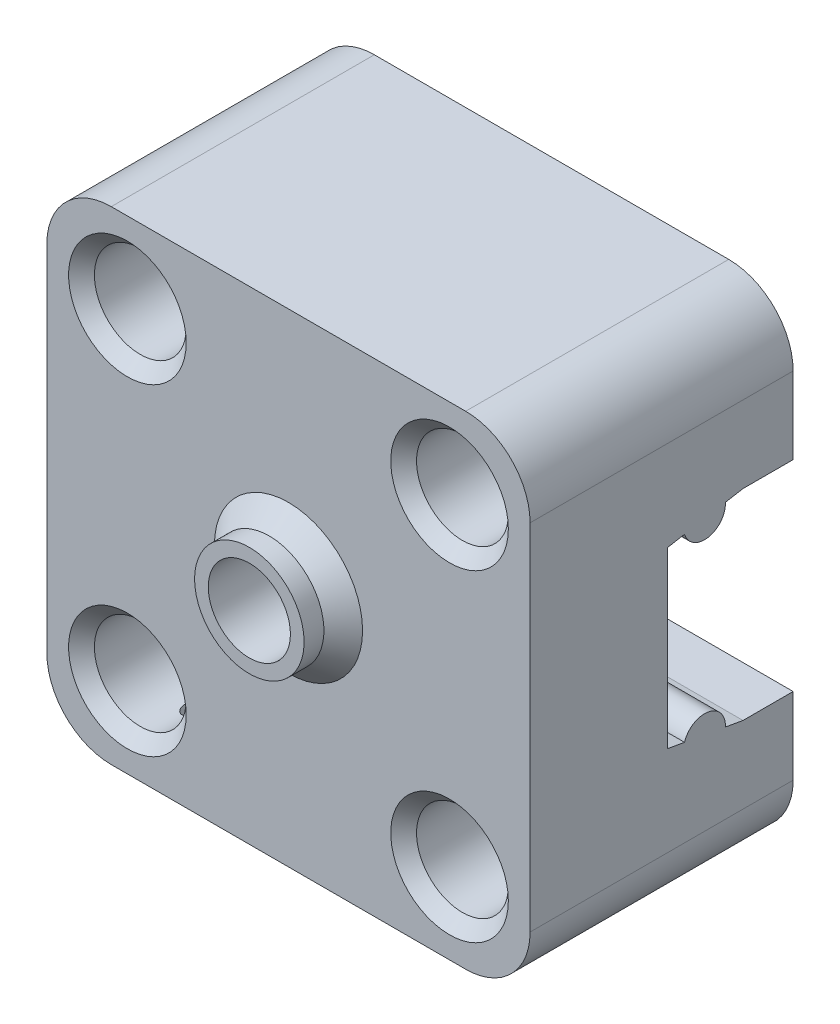
from build123d import *

# Parameters (mm, degrees)
SKETCH1_W                  = 30
SKETCH1_H                  = 30
SKETCH1_R                  = 1.6
SKETCH1_W_2                = 70
SKETCH1_H_2                = 12
BOSS_EXTRUDE1_DEPTH        = 6
SKETCH1_3_W                = 30
SKETCH1_3_H                = 30
SKETCH1_3_R                = 1.6
BOSS_EXTRUDE2_DEPTH        = 22.33
CUT_EXTRUDE1_DEPTH         = 78.612040947
SKETCH3_R                  = 2.55
CUT_EXTRUDE2_DEPTH         = 8
CUT_EXTRUDE3_DEPTH         = 4.5
SKETCH6_R                  = 5
CUT_EXTRUDE5_DEPTH         = 8.6
SKETCH7_R                  = 1.6
CUT_EXTRUDE6_DEPTH         = 101.740403513
SKETCH8_R                  = 2.85
CUT_EXTRUDE7_DEPTH         = 11
BOSS_EXTRUDE3_START        = 2.43
SKETCH9_R                  = 3.4
SKETCH9_R_2                = 2.55
BOSS_EXTRUDE3_DEPTH        = 2.43
CHAMFER1_SIZE              = 1.2
FILLET3_R                  = 4
CHAMFER2_SIZE              = 0.8
CUT_EXTRUDE8_DEPTH         = 3
CHAMFER3_SIZE              = 0.8
LPATTERN1_COUNT            = 3
LPATTERN1_PITCH            = 25
CHAMFER3_OF_LPATTERN1_SIZE = 0.8
SKETCH12_W                 = 103.210606925
SKETCH12_H                 = 33.832940417
CUT_EXTRUDE9_DEPTH         = 6
SKETCH13_R                 = 0.8
CUT_EXTRUDE10_DEPTH        = 5


with BuildPart() as part:
    # Sketch1 → Boss-Extrude1 (new body)
    # profile 1 of 2: a face of its own
    with BuildSketch(Plane.XY):
        with Locations((10, 10)):
            Rectangle(SKETCH1_W, SKETCH1_H)
        with Locations((20, 0)):
            Circle(SKETCH1_R, mode=Mode.SUBTRACT)
        with Locations((20, 20)):
            Circle(SKETCH1_R, mode=Mode.SUBTRACT)
        with Locations((0, 20)):
            Circle(SKETCH1_R, mode=Mode.SUBTRACT)
        Circle(SKETCH1_R, mode=Mode.SUBTRACT)
    # profile 2 of 2: a face of its own
    with BuildSketch(Plane.XY):
        with Locations((60, 10)):
            Rectangle(SKETCH1_W_2, SKETCH1_H_2)
    extrude(amount=BOSS_EXTRUDE1_DEPTH)

    # Sketch1<3> → Boss-Extrude2 (add)
    with BuildSketch(Plane.XY):
        with Locations((10, 10)):
            Rectangle(SKETCH1_3_W, SKETCH1_3_H)
        with Locations((20, 0)):
            Circle(SKETCH1_3_R, mode=Mode.SUBTRACT)
        with Locations((20, 20)):
            Circle(SKETCH1_3_R, mode=Mode.SUBTRACT)
        with Locations((0, 20)):
            Circle(SKETCH1_3_R, mode=Mode.SUBTRACT)
        Circle(SKETCH1_3_R, mode=Mode.SUBTRACT)
    extrude(amount=BOSS_EXTRUDE2_DEPTH)

    # Sketch2 → Cut-Extrude1 (cut, through all)
    with BuildSketch(Plane(origin=(25, 0, 0), x_dir=(0, 0, -1), z_dir=(1, 0, 0))):
        with BuildLine():
            Line((-6.515476918, 16.231667643), (-9.112158418, 16.231667643))
            Line((-9.112158418, 16.231667643), (-10.20449761, 16.039058771))
            ThreePointArc((-10.20449761, 16.039058771), (-11.275650893, 14.693383456), (-12.742453793, 15.59154862))
            Line((-12.742453793, 15.59154862), (-13.786185118, 15.407510627))
            Line((-13.786185118, 15.407510627), (-13.786185118, 4.591753459))
            Line((-13.786185118, 4.591753459), (-12.742453793, 4.407715465))
            ThreePointArc((-12.742453793, 4.407715465), (-11.275650893, 5.305880629), (-10.20449761, 3.960205314))
            Line((-10.20449761, 3.960205314), (-9.112158418, 3.767596443))
            Line((-9.112158418, 3.767596443), (-6.515476918, 3.767596443))
            Line((-6.515476918, 3.767596443), (-5.902540869, 3.767596443))
            Line((-5.902540869, 3.767596443), (-5.902540869, 16.231667643))
            Line((-5.902540869, 16.231667643), (-6.515476918, 16.231667643))
        make_face()
    extrude(amount=-CUT_EXTRUDE1_DEPTH, mode=Mode.SUBTRACT)

    # Sketch3 → Cut-Extrude2 (cut)
    with BuildSketch(Plane.XY.offset(22.33)):
        with Locations((10, 10)):
            Circle(SKETCH3_R)
    extrude(amount=-CUT_EXTRUDE2_DEPTH, mode=Mode.SUBTRACT)

    # Sketch5 → Cut-Extrude3 (cut)
    with BuildSketch(Plane(origin=(0, 0, 13.786185118), x_dir=(-1, 0, 0), z_dir=(0, 0, -1))):
        Polygon((-5.32346282, 10), (-7.66173141, 14.05), (-12.33826859, 14.05), (-14.67653718, 10), (-12.33826859, 5.95), (-7.66173141, 5.95), align=None)
    extrude(amount=-CUT_EXTRUDE3_DEPTH, mode=Mode.SUBTRACT)

    # Sketch6 → Cut-Extrude5 (cut)
    with BuildSketch(Plane(origin=(0, 0, 0), x_dir=(-1, 0, 0), z_dir=(0, 0, -1))):
        with Locations((-10, 10)):
            Circle(SKETCH6_R)
    extrude(amount=-CUT_EXTRUDE5_DEPTH, mode=Mode.SUBTRACT)

    # Sketch7 → Cut-Extrude6 (cut, through all)
    with BuildSketch(Plane(origin=(0, 0, 0), x_dir=(-1, 0, 0), z_dir=(0, 0, -1))):
        with BuildLine():
            ThreePointArc((-90.1, 10), (-88.5, 8.4), (-86.9, 10))
            Line((-86.9, 10), (-90.1, 10))
        make_face()
        with BuildLine():
            Line((-90.1, 10), (-86.9, 10))
            ThreePointArc((-86.9, 10), (-88.5, 11.6), (-90.1, 10))
        make_face()
        with Locations((-63.5, 10)):
            Circle(SKETCH7_R)
        with Locations((-38.5, 10)):
            Circle(SKETCH7_R)
    extrude(amount=-CUT_EXTRUDE6_DEPTH, mode=Mode.SUBTRACT)

    # Sketch8 → Cut-Extrude7 (cut)
    with BuildSketch(Plane.XY.offset(22.33)):
        with Locations((20, 20)):
            Circle(SKETCH8_R)
        with Locations((20, 0)):
            Circle(SKETCH8_R)
        Circle(SKETCH8_R)
        with Locations((0, 20)):
            Circle(SKETCH8_R)
    extrude(amount=-CUT_EXTRUDE7_DEPTH, mode=Mode.SUBTRACT)

    # Sketch9 → Boss-Extrude3 (add)
    with BuildSketch(Plane.XY.offset(22.33).offset(BOSS_EXTRUDE3_START)):
        with Locations(Location((10, 10, 0), (0, 0, 180))):
            Circle(SKETCH9_R)
        with Locations((10, 10)):
            Circle(SKETCH9_R_2, mode=Mode.SUBTRACT)
    extrude(amount=-BOSS_EXTRUDE3_DEPTH)

    # Chamfer1
    chamfer1_edges = [part.edges().sort_by_distance(p)[0] for p in [
        (13.4, 10, 22.33),
    ]]
    chamfer(chamfer1_edges, length=CHAMFER1_SIZE)

    # Fillet3
    # the kernel refuses this fillet: 4 mm, written as the material it adds along each edge
    with BuildSketch(Plane(origin=(25, 4, 0), x_dir=(0, -1, 0), z_dir=(0, 0, 1))) as fillet3_piece_1:
        with BuildLine():
            CenterArc((FILLET3_R, FILLET3_R), FILLET3_R, 180, 90)
            Line((0, FILLET3_R), (0, 0))
            Line((0, 0), (FILLET3_R, 0))
        make_face()
    extrude(amount=5.902540869)
    with BuildSketch(Plane(origin=(25, 16, 0), x_dir=(0, 1, 0), z_dir=(0, 0, 1))) as fillet3_piece_2:
        with BuildLine():
            CenterArc((FILLET3_R, -FILLET3_R), FILLET3_R, 90, 90)
            Line((0, -FILLET3_R), (0, 0))
            Line((0, 0), (FILLET3_R, 0))
        make_face()
    extrude(amount=5.902540869)
    # the kernel refuses this fillet: 4 mm, written as the material it takes off along each edge
    with BuildSketch(Plane(origin=(-5, -5, 32.33), x_dir=(1, 0, 0), z_dir=(0, 0, -1)), Plane(origin=(-5, 25, 32.33), x_dir=(0, -1, 0), z_dir=(0, 0, -1)), Plane(origin=(25, 25, -10), x_dir=(0, -1, 0), z_dir=(0, 0, 1)), Plane(origin=(25, -5, -10), x_dir=(-1, 0, 0), z_dir=(0, 0, 1))) as fillet3_2_piece_1:
        with BuildLine():
            CenterArc((FILLET3_R, -FILLET3_R), FILLET3_R, 90, 90)
            Line((0, -FILLET3_R), (0, 0))
            Line((0, 0), (FILLET3_R, 0))
        make_face()
    extrude(amount=42.33, mode=Mode.SUBTRACT)
    with BuildSketch(Plane(origin=(95, 16, -10), x_dir=(-1, 0, 0), z_dir=(0, 0, 1))) as fillet3_2_piece_2:
        with BuildLine():
            CenterArc((FILLET3_R, FILLET3_R), FILLET3_R, 180, 90)
            Line((0, FILLET3_R), (0, 0))
            Line((0, 0), (FILLET3_R, 0))
        make_face()
    extrude(amount=26, mode=Mode.SUBTRACT)
    with BuildSketch(Plane(origin=(95, 4, -10), x_dir=(-1, 0, 0), z_dir=(0, 0, 1))) as fillet3_2_piece_3:
        with BuildLine():
            CenterArc((FILLET3_R, -FILLET3_R), FILLET3_R, 90, 90)
            Line((0, -FILLET3_R), (0, 0))
            Line((0, 0), (FILLET3_R, 0))
        make_face()
    extrude(amount=26, mode=Mode.SUBTRACT)

    # Chamfer2
    chamfer2_edges = [part.edges().sort_by_distance(p)[0] for p in [
        (-2.85, 20, 22.33),
        (-2.85, 0, 22.33),
        (17.15, 0, 22.33),
        (17.15, 20, 22.33),
    ]]
    chamfer(chamfer2_edges, length=CHAMFER2_SIZE)

    # Sketch10 → Cut-Extrude8 (cut)
    with BuildSketch(Plane(origin=(0, 0, 0), x_dir=(-1, 0, 0), z_dir=(0, 0, -1))):
        Polygon((-85.266838493, 10), (-86.883419246, 12.8), (-90.116580754, 12.8), (-91.733161507, 10), (-90.116580754, 7.2), (-86.883419246, 7.2), align=None)
    cut_extrude8 = extrude(amount=-CUT_EXTRUDE8_DEPTH, mode=Mode.SUBTRACT)

    # Chamfer3
    chamfer3_edges = [part.edges().sort_by_distance(p)[0] for p in [
        (86.075128869, 8.6, 0),
        (86.075128869, 11.4, 0),
        (88.5, 12.8, 0),
        (90.924871131, 11.4, 0),
        (90.924871131, 8.6, 0),
        (88.5, 7.2, 0),
    ]]
    chamfer(chamfer3_edges, length=CHAMFER3_SIZE)

    # LPattern1: Cut-Extrude8 ×3
    with Locations(*[(-i * LPATTERN1_PITCH, 0, 0) for i in range(1, LPATTERN1_COUNT)]):
        add(cut_extrude8, mode=Mode.SUBTRACT)

    # Chamfer3 of LPattern1
    chamfer3_of_lpattern1_edges = [part.edges().sort_by_distance(p)[0] for p in [
        (61.075128869, 8.6, 0),
        (61.075128869, 11.4, 0),
        (63.5, 12.8, 0),
        (65.924871131, 11.4, 0),
        (65.924871131, 8.6, 0),
        (63.5, 7.2, 0),
        (36.075128869, 8.6, 0),
        (36.075128869, 11.4, 0),
        (38.5, 12.8, 0),
        (40.924871131, 11.4, 0),
        (40.924871131, 8.6, 0),
        (38.5, 7.2, 0),
    ]]
    chamfer(chamfer3_of_lpattern1_edges, length=CHAMFER3_OF_LPATTERN1_SIZE)

    # Sketch12 → Cut-Extrude9 (cut)
    with BuildSketch(Plane(origin=(0, 0, 0), x_dir=(-1, 0, 0), z_dir=(0, 0, -1))):
        with Locations((-45.050346637, 9.848960088)):
            Rectangle(SKETCH12_W, SKETCH12_H)
    extrude(amount=-CUT_EXTRUDE9_DEPTH, mode=Mode.SUBTRACT)

    # Sketch13 → Cut-Extrude10 (cut)
    with BuildSketch(Plane.XZ.offset(5)):
        with Locations(Location((1, 18.949828429, 0), (0, 0, 270))):
            Circle(SKETCH13_R)
        with Locations(Location((1, 12.449828429, 0), (0, 0, 270))):
            Circle(SKETCH13_R)
    extrude(amount=-CUT_EXTRUDE10_DEPTH, mode=Mode.SUBTRACT)


solid = part.part
